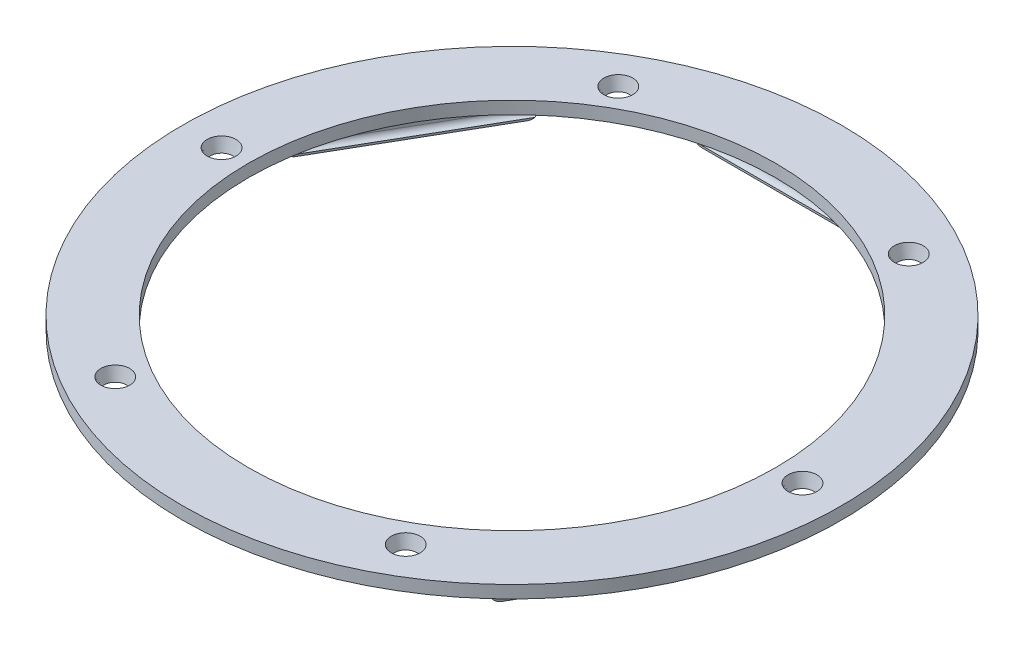
from build123d import *

# Parameters (mm, degrees)
BOSS_EXTRUDE2_START       = -3.5
SKETCH1_W                 = 30
SKETCH1_H                 = 2.35
BOSS_EXTRUDE2_DEPTH       = 4.5
SKETCH3_R                 = 52.5
SKETCH3_R_2               = 42
SKETCH3_R_3               = 1.5
BOSS_EXTRUDE3_DEPTH       = 2
CHAMFER1_SIZE             = 3
CHAMFER1_SIZE_2           = 0.803847577
FILLET1_R                 = 1.5
F_1_0MM_START             = -15
F_1_0MM_DOWEL_SLOT1_DEPTH = 30
CIRPATTERN1_COUNT         = 6
FILLET1_OF_CIRPATTERN1_R  = 1.5


# Read off the part's stored shape, not the designer's step: Ø1.0mm Dowel Slot1
with BuildPart() as part:
    # Sketch1 → Boss-Extrude2 (new body)
    with BuildSketch(Plane(origin=(0, 0, 0), x_dir=(1, 0, 0), z_dir=(0, 1, 0)).offset(BOSS_EXTRUDE2_START)):
        with Locations((0, -44.925)):
            Rectangle(SKETCH1_W, SKETCH1_H)
    boss_extrude2 = extrude(amount=BOSS_EXTRUDE2_DEPTH)

    # Sketch3 → Boss-Extrude3 (add)
    with BuildSketch(Plane(origin=(0, 0, 0), x_dir=(1, 0, 0), z_dir=(0, 1, 0))):
        with Locations(Location((0, 0, 0), (0, 0, 270))):
            Circle(SKETCH3_R)
        with Locations(Location((0, 0, 0), (0, 0, 270))):
            Circle(SKETCH3_R_2, mode=Mode.SUBTRACT)
        with Locations(Location((-23.135, 40.070995433, 0), (0, 0, 270))):
            Circle(SKETCH3_R_3, mode=Mode.SUBTRACT)
        with Locations(Location((23.135, 40.070995433, 0), (0, 0, 270))):
            Circle(SKETCH3_R_3, mode=Mode.SUBTRACT)
        with Locations(Location((46.27, 0, 0), (0, 0, 270))):
            Circle(SKETCH3_R_3, mode=Mode.SUBTRACT)
        with Locations(Location((23.135, -40.070995433, 0), (0, 0, 270))):
            Circle(SKETCH3_R_3, mode=Mode.SUBTRACT)
        with Locations(Location((-23.135, -40.070995433, 0), (0, 0, 270))):
            Circle(SKETCH3_R_3, mode=Mode.SUBTRACT)
        with Locations(Location((-46.27, 0, 0), (0, 0, 270))):
            Circle(SKETCH3_R_3, mode=Mode.SUBTRACT)
    extrude(amount=BOSS_EXTRUDE3_DEPTH)

    # Chamfer1
    # the kernel refuses this chamfer: 3, 0.803847577 mm, written as the material it takes off along each edge
    with BuildSketch(Plane(origin=(23.135, 2, 40.070995433), x_dir=(0, 0, 1), z_dir=(-1, 0, 0))) as chamfer1_piece_1:
        Polygon((1.5, -CHAMFER1_SIZE), (1.5 + CHAMFER1_SIZE_2, 0), (1.5, 0), align=None)
    revolve(axis=Axis((23.135, 2, 40.070995433), (0, 1, 0)), mode=Mode.SUBTRACT)
    with BuildSketch(Plane(origin=(46.27, 2, 0), x_dir=(0, 0, 1), z_dir=(-1, 0, 0))) as chamfer1_piece_2:
        Polygon((1.5, -CHAMFER1_SIZE), (1.5 + CHAMFER1_SIZE_2, 0), (1.5, 0), align=None)
    revolve(axis=Axis((46.27, 2, 0), (0, 1, 0)), mode=Mode.SUBTRACT)
    with BuildSketch(Plane(origin=(23.135, 2, -40.070995433), x_dir=(0, 0, 1), z_dir=(-1, 0, 0))) as chamfer1_piece_3:
        Polygon((1.5, -CHAMFER1_SIZE), (1.5 + CHAMFER1_SIZE_2, 0), (1.5, 0), align=None)
    revolve(axis=Axis((23.135, 2, -40.070995433), (0, 1, 0)), mode=Mode.SUBTRACT)
    with BuildSketch(Plane(origin=(-23.135, 2, -40.070995433), x_dir=(0, 0, 1), z_dir=(-1, 0, 0))) as chamfer1_piece_4:
        Polygon((1.5, -CHAMFER1_SIZE), (1.5 + CHAMFER1_SIZE_2, 0), (1.5, 0), align=None)
    revolve(axis=Axis((-23.135, 2, -40.070995433), (0, 1, 0)), mode=Mode.SUBTRACT)
    with BuildSketch(Plane(origin=(-46.27, 2, 0), x_dir=(0, 0, 1), z_dir=(-1, 0, 0))) as chamfer1_piece_5:
        Polygon((1.5, -CHAMFER1_SIZE), (1.5 + CHAMFER1_SIZE_2, 0), (1.5, 0), align=None)
    revolve(axis=Axis((-46.27, 2, 0), (0, 1, 0)), mode=Mode.SUBTRACT)
    with BuildSketch(Plane(origin=(-23.135, 2, 40.070995433), x_dir=(0, 0, 1), z_dir=(-1, 0, 0))) as chamfer1_piece_6:
        Polygon((1.5, -CHAMFER1_SIZE), (1.5 + CHAMFER1_SIZE_2, 0), (1.5, 0), align=None)
    revolve(axis=Axis((-23.135, 2, 40.070995433), (0, 1, 0)), mode=Mode.SUBTRACT)

    # Fillet1
    fillet1_edges = [part.edges().sort_by_distance(p)[0] for p in [
        (-15, -3.5, 44.925),
        (15, -3.5, 44.925),
    ]]
    fillet(fillet1_edges, radius=FILLET1_R)

    # Ø1.0mm Dowel Slot1 outline → Ø1.0mm Dowel Slot1 (cut)
    with BuildSketch(Plane.YZ.offset(F_1_0MM_START)):
        with BuildLine():
            ThreePointArc((-0.3132503, 43.75), (-0.679912287, 44.221583836), (-1.25, 44.4))
            Line((-1.25, 44.4), (-2.25, 44.4))
            ThreePointArc((-2.25, 44.4), (-2.820087713, 44.221583836), (-3.1867497, 43.75))
            Line((-3.1867497, 43.75), (-0.3132503, 43.75))
        make_face()
    f_1_0mm_dowel_slot1 = extrude(amount=F_1_0MM_DOWEL_SLOT1_DEPTH, mode=Mode.SUBTRACT)

    # CirPattern1: Boss-Extrude2, Ø1.0mm Dowel Slot1 ×6 about axis
    cirpattern1_axis = Axis((0, 0, 0), (0, 1, 0))
    add([boss_extrude2.rotate(cirpattern1_axis, i * 360 / CIRPATTERN1_COUNT) for i in range(1, CIRPATTERN1_COUNT)])
    add([f_1_0mm_dowel_slot1.rotate(cirpattern1_axis, i * 360 / CIRPATTERN1_COUNT) for i in range(1, CIRPATTERN1_COUNT)], mode=Mode.SUBTRACT)

    # Fillet1 of CirPattern1
    fillet1_of_cirpattern1_edges = [part.edges().sort_by_distance(p)[0] for p in [
        (31.406191265, -3.5, 35.452881057),
        (46.406191265, -3.5, 9.472118943),
        (46.406191265, -3.5, -9.472118943),
        (31.406191265, -3.5, -35.452881057),
        (15, -3.5, -44.925),
        (-15, -3.5, -44.925),
        (-31.406191265, -3.5, -35.452881057),
        (-46.406191265, -3.5, -9.472118943),
        (-46.406191265, -3.5, 9.472118943),
        (-31.406191265, -3.5, 35.452881057),
    ]]
    fillet(fillet1_of_cirpattern1_edges, radius=FILLET1_OF_CIRPATTERN1_R)


solid = part.part
